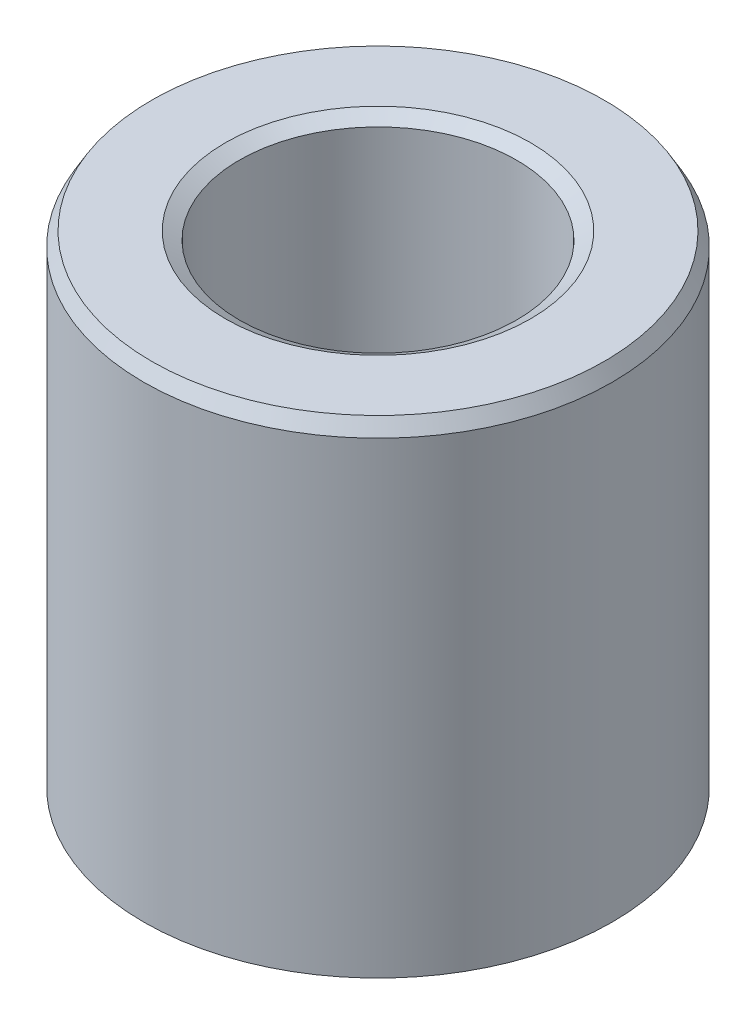
from build123d import *
from OCP.BRepFilletAPI import BRepFilletAPI_MakeChamfer

# Parameters (mm, degrees)
SKETCH1_R           = 10
BOSS_EXTRUDE1_DEPTH = 20.891030634
SKETCH2_R           = 5.914247162
CUT_EXTRUDE1_DEPTH  = 26.227666578
CHAMFER1_SIZE       = 0.596427583
CHAMFER1_SIZE2      = 0.344347625


with BuildPart() as part:
    # Sketch1 → Boss-Extrude1 (new body)
    with BuildSketch(Plane(origin=(0, 0, 0), x_dir=(1, 0, 0), z_dir=(0, 1, 0))):
        Circle(SKETCH1_R)
    extrude(amount=BOSS_EXTRUDE1_DEPTH)

    # Sketch2 → Cut-Extrude1 (cut, through all)
    with BuildSketch(Plane(origin=(0, 0, 0), x_dir=(1, 0, 0), z_dir=(0, 1, 0))):
        Circle(SKETCH2_R)
    extrude(amount=CUT_EXTRUDE1_DEPTH, mode=Mode.SUBTRACT)

    # Chamfer1: one chamfer whose edges measure the first distance from different faces: ONE call of the kernel's chamfer builder (chamfer() names one face for all edges)
    chamfer1_edges_1 = [part.edges().sort_by_distance(p)[0] for p in [
        (-5.914247162, 20.891030634, 0),
    ]]
    chamfer1_side_1 = [part.faces().sort_by_distance(p)[0] for p in [
        (-9.717157288, 20.891030634, 0),
    ]]
    chamfer1_edges_2 = [part.edges().sort_by_distance(p)[0] for p in [
        (-5.914247162, 0, 0),
    ]]
    chamfer1_side_2 = [part.faces().sort_by_distance(p)[0] for p in [
        (-5.914247162, 10.445515317, 0),
    ]]
    chamfer1_edges_3 = [part.edges().sort_by_distance(p)[0] for p in [
        (-10, 0, 0),
    ]]
    chamfer1_side_3 = [part.faces().sort_by_distance(p)[0] for p in [
        (-9.717157288, 0, 0),
    ]]
    chamfer1_edges_4 = [part.edges().sort_by_distance(p)[0] for p in [
        (-10, 20.891030634, 0),
    ]]
    chamfer1_side_4 = [part.faces().sort_by_distance(p)[0] for p in [
        (-10, 10.445515317, 0),
    ]]
    chamfer1 = BRepFilletAPI_MakeChamfer(part.part.solid().wrapped)
    for e in chamfer1_edges_1:
        chamfer1.Add(CHAMFER1_SIZE, CHAMFER1_SIZE2, e.wrapped, chamfer1_side_1[0].wrapped)  # the first distance lies on this face
    for e in chamfer1_edges_2:
        chamfer1.Add(CHAMFER1_SIZE, CHAMFER1_SIZE2, e.wrapped, chamfer1_side_2[0].wrapped)  # the first distance lies on this face
    for e in chamfer1_edges_3:
        chamfer1.Add(CHAMFER1_SIZE, CHAMFER1_SIZE2, e.wrapped, chamfer1_side_3[0].wrapped)  # the first distance lies on this face
    for e in chamfer1_edges_4:
        chamfer1.Add(CHAMFER1_SIZE, CHAMFER1_SIZE2, e.wrapped, chamfer1_side_4[0].wrapped)  # the first distance lies on this face
    add(Compound.cast(chamfer1.Shape()), mode=Mode.REPLACE)


solid = part.part
